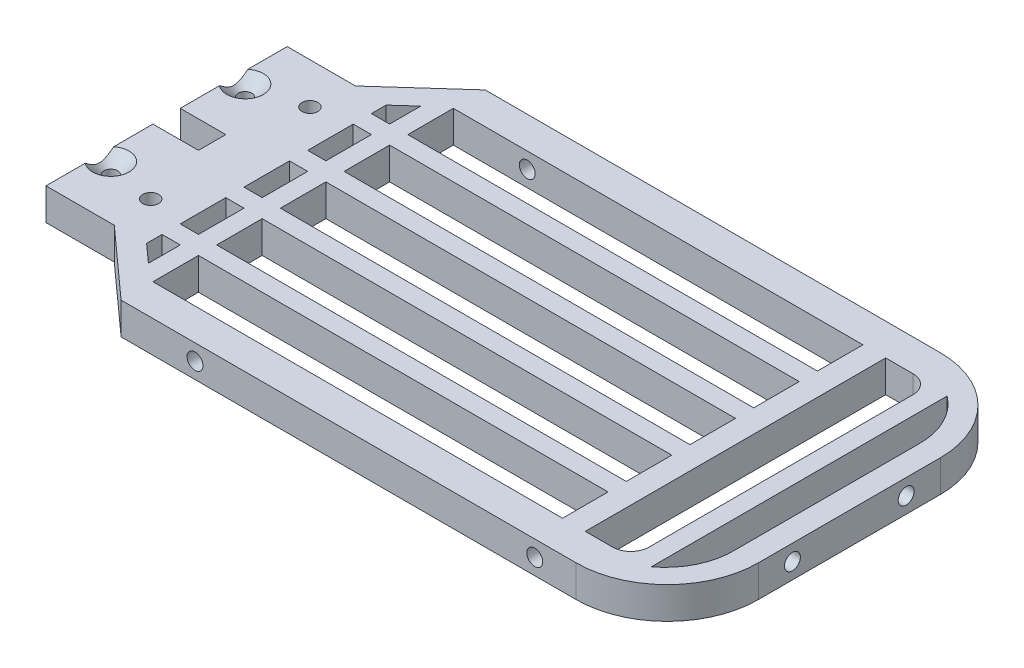
from build123d import *

# Parameters (mm, degrees)
Y_KSEKLIK_EKSTR_ZYON1_DEPTH = 7
IZIM2_R                     = 1.5
KES_EKSTR_ZYON1_DEPTH       = 7
PAH1_SIZE                   = 2.5
IZIM3_R                     = 1.75
KES_EKSTR_ZYON2_DEPTH       = 10
KES_EKSTR_ZYON3_START       = -10
IZIM4_R                     = 1.75
KES_EKSTR_ZYON3_DEPTH       = 10
RADYUS1_R                   = 20
IZIM5_W                     = 90
IZIM5_H                     = 10
IZIM5_W_2                   = 10
IZIM5_H_2                   = 66
KES_EKSTR_ZYON4_DEPTH       = 10
RADYUS2_R                   = 4
KES_EKSTR_ZYON5_DEPTH       = 10
IZIM7_R                     = 1.75
KES_EKSTR_ZYON6_DEPTH       = 7
IZIM8_W                     = 10
IZIM8_H                     = 6
KES_EKSTR_ZYON7_DEPTH       = 10
IZIM9_R                     = 1.75
KES_EKSTR_ZYON8_DEPTH       = 10
IZIM10_R                    = 1.75
KES_EKSTR_ZYON9_DEPTH       = 6
KES_EKSTR_ZYON10_START      = -6
IZIM11_R                    = 1.75
KES_EKSTR_ZYON10_DEPTH      = 6
IZIM12_W                    = 4
IZIM12_H                    = 10
KES_EKSTR_ZYON11_DEPTH      = 10


with BuildPart() as part:
    # Çizim1 → Yükseklik-Ekstrüzyon1 (new body)
    with BuildSketch(Plane(origin=(0, 0, 0), x_dir=(1, 0, 0), z_dir=(0, 1, 0))):
        Polygon((0, 0), (0, 53), (15, 53), (30, 66.5), (150, 66.5), (150, -13.5), (30, -13.5), (15, 0), align=None)
    extrude(amount=Y_KSEKLIK_EKSTR_ZYON1_DEPTH)

    # Çizim2 → Kes-Ekstrüzyon1 (cut)
    with BuildSketch(Plane(origin=(0, 7, 0), x_dir=(1, 0, 0), z_dir=(0, 1, 0))):
        with Locations(Location((2.5, 41.25, 0), (0, 0, 270))):
            Circle(IZIM2_R)
        with Locations(Location((2.5, 11.75, 0), (0, 0, 270))):
            Circle(IZIM2_R)
    extrude(amount=-KES_EKSTR_ZYON1_DEPTH, mode=Mode.SUBTRACT)

    # Pah1
    # the kernel refuses this chamfer: 2.5 mm, written as the material it takes off along each edge
    with BuildSketch(Plane(origin=(2.5, 7, -41.25), x_dir=(0, 0, 1), z_dir=(-1, 0, 0))) as pah1_piece_1:
        Polygon((1.5 + PAH1_SIZE, 0), (1.5, -PAH1_SIZE), (1.5, 0), align=None)
    revolve(axis=Axis((2.5, 7, -41.25), (0, 1, 0)), mode=Mode.SUBTRACT)
    with BuildSketch(Plane(origin=(2.5, 7, -11.75), x_dir=(0, 0, 1), z_dir=(-1, 0, 0))) as pah1_piece_2:
        Polygon((1.5 + PAH1_SIZE, 0), (1.5, -PAH1_SIZE), (1.5, 0), align=None)
    revolve(axis=Axis((2.5, 7, -11.75), (0, 1, 0)), mode=Mode.SUBTRACT)

    # Çizim3 → Kes-Ekstrüzyon2 (cut)
    with BuildSketch(Plane.XY.offset(13.5)):
        with Locations((46.24, 3.5)):
            Circle(IZIM3_R)
    extrude(amount=-KES_EKSTR_ZYON2_DEPTH, mode=Mode.SUBTRACT)

    # Çizim4 → Kes-Ekstrüzyon3 (cut)
    with BuildSketch(Plane(origin=(0, 0, -66.5), x_dir=(-1, 0, 0), z_dir=(0, 0, -1)).offset(KES_EKSTR_ZYON3_START)):
        with Locations(Location((-46.24, 3.5, 0), (0, 0, 180))):
            Circle(IZIM4_R)
    extrude(amount=KES_EKSTR_ZYON3_DEPTH, mode=Mode.SUBTRACT)

    # Radyus1
    radyus1_edges = [part.edges().sort_by_distance(p)[0] for p in [
        (150, 3.5, -66.5),
        (150, 3.5, 13.5),
    ]]
    fillet(radyus1_edges, radius=RADYUS1_R)

    # Çizim5 → Kes-Ekstrüzyon4 (cut)
    with BuildSketch(Plane(origin=(0, 7, 0), x_dir=(1, 0, 0), z_dir=(0, 1, 0))):
        with Locations((75, -1.5)):
            Rectangle(IZIM5_W, IZIM5_H)
        with Locations((75, 26.5)):
            Rectangle(IZIM5_W, IZIM5_H)
        with Locations((75, 40.5)):
            Rectangle(IZIM5_W, IZIM5_H)
        with Locations((75, 54.5)):
            Rectangle(IZIM5_W, IZIM5_H)
        with Locations((75, 12.5)):
            Rectangle(IZIM5_W, IZIM5_H)
        with Locations((130, 26.5)):
            Rectangle(IZIM5_W_2, IZIM5_H_2)
    extrude(amount=-KES_EKSTR_ZYON4_DEPTH, mode=Mode.SUBTRACT)

    # Radyus2
    radyus2_edges = [part.edges().sort_by_distance(p)[0] for p in [
        (135, 3.5, -59.5),
        (135, 3.5, 6.5),
    ]]
    fillet(radyus2_edges, radius=RADYUS2_R)

    # Çizim6 → Kes-Ekstrüzyon5 (cut)
    with BuildSketch(Plane(origin=(0, 7, 0), x_dir=(1, 0, 0), z_dir=(0, 1, 0))):
        with BuildLine():
            Line((139, -6), (139, 59))
            ThreePointArc((139, 59), (143.530979443, 53.484870133), (145, 46.5))
            Line((145, 46.5), (145, 6.5))
            ThreePointArc((145, 6.5), (143.530979443, -0.484870133), (139, -6))
        make_face()
    extrude(amount=-KES_EKSTR_ZYON5_DEPTH, mode=Mode.SUBTRACT)

    # Çizim7 → Kes-Ekstrüzyon6 (cut)
    with BuildSketch(Plane(origin=(150, 0, 0), x_dir=(0, 0, -1), z_dir=(1, 0, 0))):
        with Locations((14, 3.5)):
            Circle(IZIM7_R)
        with Locations((39, 3.5)):
            Circle(IZIM7_R)
    extrude(amount=-KES_EKSTR_ZYON6_DEPTH, mode=Mode.SUBTRACT)

    # Çizim8 → Kes-Ekstrüzyon7 (cut)
    with BuildSketch(Plane(origin=(0, 7, 0), x_dir=(1, 0, 0), z_dir=(0, 1, 0))):
        with Locations((5, 26.5)):
            Rectangle(IZIM8_W, IZIM8_H)
    extrude(amount=-KES_EKSTR_ZYON7_DEPTH, mode=Mode.SUBTRACT)

    # Çizim9 → Kes-Ekstrüzyon8 (cut)
    with BuildSketch(Plane(origin=(0, 7, 0), x_dir=(1, 0, 0), z_dir=(0, 1, 0))):
        with Locations(Location((14, 44, 0), (0, 0, 270))):
            Circle(IZIM9_R)
        with Locations(Location((14, 9, 0), (0, 0, 270))):
            Circle(IZIM9_R)
    extrude(amount=-KES_EKSTR_ZYON8_DEPTH, mode=Mode.SUBTRACT)

    # Çizim10 → Kes-Ekstrüzyon9 (cut)
    with BuildSketch(Plane.XY.offset(13.5)):
        with Locations((120.89, 3.5)):
            Circle(IZIM10_R)
    extrude(amount=-KES_EKSTR_ZYON9_DEPTH, mode=Mode.SUBTRACT)

    # Çizim11 → Kes-Ekstrüzyon10 (cut)
    with BuildSketch(Plane(origin=(0, 0, -66.5), x_dir=(-1, 0, 0), z_dir=(0, 0, -1)).offset(KES_EKSTR_ZYON10_START)):
        with Locations(Location((-120.89, 3.5, 0), (0, 0, 180))):
            Circle(IZIM11_R)
    extrude(amount=KES_EKSTR_ZYON10_DEPTH, mode=Mode.SUBTRACT)

    # Çizim12 → Kes-Ekstrüzyon11 (cut)
    with BuildSketch(Plane(origin=(0, 7, 0), x_dir=(1, 0, 0), z_dir=(0, 1, 0))):
        Polygon((26, 56.331873347), (26, 49.5), (22, 49.5), (22, 52.731873347), align=None)
        Polygon((26, -3.5), (22, 0.1), (22, 3.5), (26, 3.5), align=None)
        with Locations((24, 40.5)):
            Rectangle(IZIM12_W, IZIM12_H)
        with Locations((24, 26.5)):
            Rectangle(IZIM12_W, IZIM12_H)
        with Locations((24, 12.5)):
            Rectangle(IZIM12_W, IZIM12_H)
    extrude(amount=-KES_EKSTR_ZYON11_DEPTH, mode=Mode.SUBTRACT)


solid = part.part
